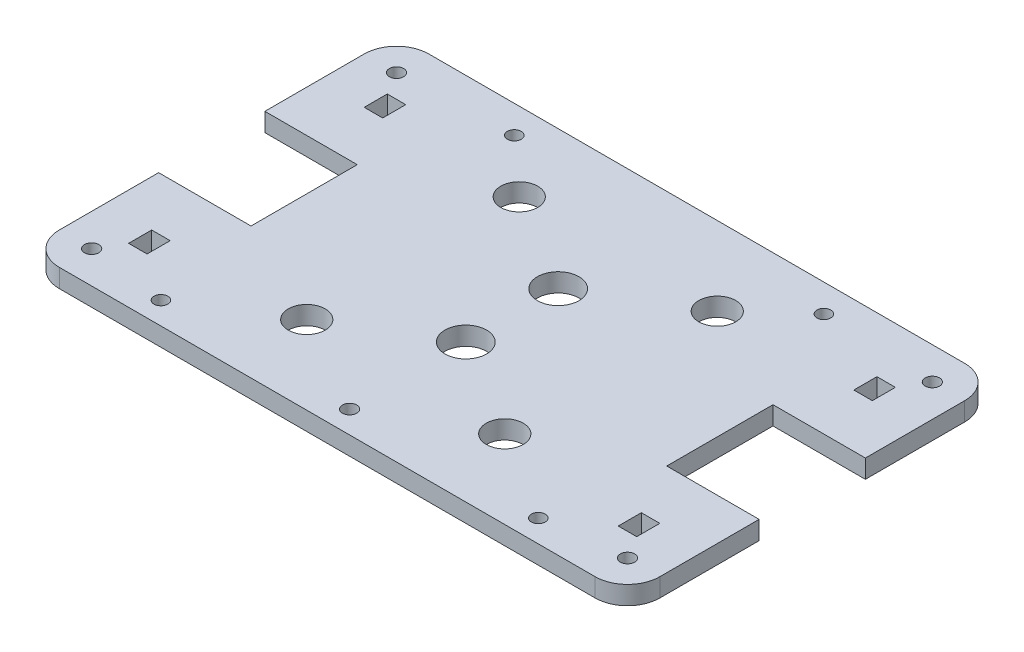
from build123d import *

# Parameters (mm, degrees)
SKETCH1_R           = 1.55
SKETCH1_R_2         = 1.5
SKETCH1_R_3         = 4.5
SKETCH1_R_4         = 4
SKETCH1_W           = 4
SKETCH1_H           = 5
BOSS_EXTRUDE1_DEPTH = 4


with BuildPart() as part:
    # Sketch1 → Boss-Extrude1 (new body)
    with BuildSketch(Plane(origin=(0, 0, 0), x_dir=(1, 0, 0), z_dir=(0, 1, 0))):
        with BuildLine():
            Line((45, -11.5), (45, 11.5))
            Line((45, 11.5), (65, 11.5))
            Line((65, 11.5), (65, 33))
            ThreePointArc((65, 33), (62.949747468, 37.949747468), (58, 40))
            Line((58, 40), (-58, 40))
            ThreePointArc((-58, 40), (-62.949747468, 37.949747468), (-65, 33))
            Line((-65, 33), (-65, 11.5))
            Line((-65, 11.5), (-45, 11.5))
            Line((-45, 11.5), (-45, -11.5))
            Line((-45, -11.5), (-65, -11.5))
            Line((-65, -11.5), (-65, -33))
            ThreePointArc((-65, -33), (-62.949747468, -37.949747468), (-58, -40))
            Line((-58, -40), (58, -40))
            ThreePointArc((58, -40), (62.949747468, -37.949747468), (65, -33))
            Line((65, -33), (65, -11.5))
            Line((65, -11.5), (45, -11.5))
        make_face()
        with Locations((58, 33)):
            Circle(SKETCH1_R, mode=Mode.SUBTRACT)
        with Locations((58, -33)):
            Circle(SKETCH1_R, mode=Mode.SUBTRACT)
        with Locations((-58, -33)):
            Circle(SKETCH1_R, mode=Mode.SUBTRACT)
        with Locations((-58, 33)):
            Circle(SKETCH1_R, mode=Mode.SUBTRACT)
        with Locations((33.5, 34)):
            Circle(SKETCH1_R_2, mode=Mode.SUBTRACT)
        with Locations((-33.5, 34)):
            Circle(SKETCH1_R_2, mode=Mode.SUBTRACT)
        with Locations((-40.847291444, -35.157580257)):
            Circle(SKETCH1_R_2, mode=Mode.SUBTRACT)
        with Locations((0, -35.15624759)):
            Circle(SKETCH1_R, mode=Mode.SUBTRACT)
        with Locations((40.847291444, -35.157580257)):
            Circle(SKETCH1_R_2, mode=Mode.SUBTRACT)
        with Locations((0, -10)):
            Circle(SKETCH1_R_3, mode=Mode.SUBTRACT)
        with Locations((0, 10)):
            Circle(SKETCH1_R_3, mode=Mode.SUBTRACT)
        with Locations((21.434820624, -23)):
            Circle(SKETCH1_R_4, mode=Mode.SUBTRACT)
        with Locations((-21.434820624, -23)):
            Circle(SKETCH1_R_4, mode=Mode.SUBTRACT)
        with Locations((-21.434820624, 23)):
            Circle(SKETCH1_R_4, mode=Mode.SUBTRACT)
        with Locations((21.434820624, 23)):
            Circle(SKETCH1_R_4, mode=Mode.SUBTRACT)
        with Locations((53, -25.5)):
            Rectangle(SKETCH1_W, SKETCH1_H, mode=Mode.SUBTRACT)
        with Locations((53, 25.5)):
            Rectangle(SKETCH1_W, SKETCH1_H, mode=Mode.SUBTRACT)
        with Locations((-53, -25.5)):
            Rectangle(SKETCH1_W, SKETCH1_H, mode=Mode.SUBTRACT)
        with Locations((-53, 25.5)):
            Rectangle(SKETCH1_W, SKETCH1_H, mode=Mode.SUBTRACT)
    extrude(amount=BOSS_EXTRUDE1_DEPTH)


solid = part.part
